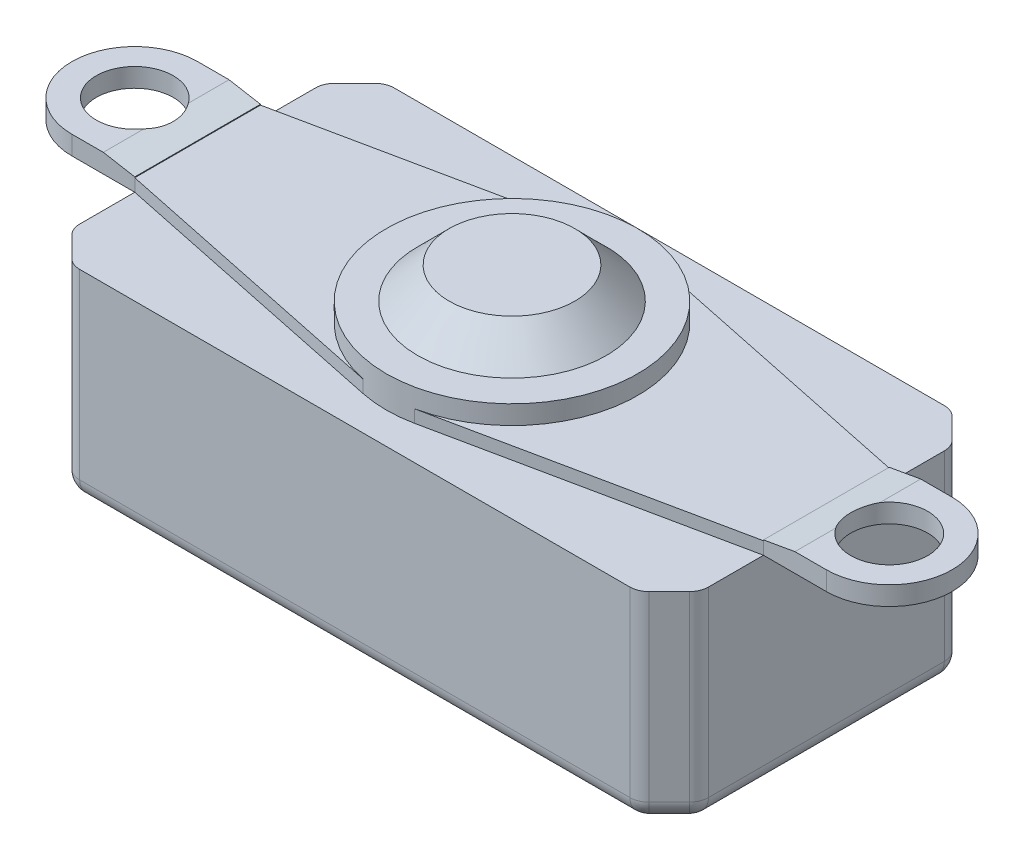
from build123d import *
from OCP.BRepFilletAPI import BRepFilletAPI_MakeChamfer

# Parameters (mm, degrees)
SKETCH1_W                               = 100
SKETCH1_H                               = 50
BOSS_EXTRUDE1_DEPTH                     = 16
SKETCH2_R                               = 20
BOSS_EXTRUDE2_DEPTH                     = 5
BOSS_EXTRUDE3_DEPTH                     = 2
BOSS_EXTRUDE4_DEPTH                     = 3
CHAMFER1_SIZE                           = 5
CHAMFER1_SIZE2                          = 0.881634904
SKETCH3_R                               = 15
BOSS_EXTRUDE5_DEPTH                     = 5
BOSS_EXTRUDE5_TAPER                     = 45
CBORE_FOR_M5_HEX_HEAD_BOLT1_D           = 5.3
CBORE_FOR_M5_HEX_HEAD_BOLT1_DEPTH       = 15
CBORE_FOR_M5_HEX_HEAD_BOLT1_CBORE_D     = 12.24
CBORE_FOR_M5_HEX_HEAD_BOLT1_CBORE_DEPTH = 3.58
CBORE_FOR_M5_HEX_HEAD_BOLT1_TIP         = 1.59228064
CHAMFER2_SIZE                           = 5
FILLET3_R                               = 3


# Read off the part's stored shape, not the designer's step: Boss-Extrude4
with BuildPart() as part:
    # Sketch1 → Boss-Extrude1 (new, symmetric)
    with BuildSketch(Plane(origin=(0, 0, 0), x_dir=(1, 0, 0), z_dir=(0, 1, 0))):
        Rectangle(SKETCH1_W, SKETCH1_H)
    extrude(amount=BOSS_EXTRUDE1_DEPTH, both=True)

    # Sketch2 → Boss-Extrude2 (add)
    with BuildSketch(Plane(origin=(0, 16, 0), x_dir=(1, 0, 0), z_dir=(0, 1, 0))):
        with Locations(Location((0, 0, 0), (0, 0, 90))):
            Circle(SKETCH2_R)
    extrude(amount=BOSS_EXTRUDE2_DEPTH)

    # Sketch2<3> → Boss-Extrude3 (add)
    with BuildSketch(Plane(origin=(0, 16, 0), x_dir=(1, 0, 0), z_dir=(0, 1, 0))):
        with BuildLine():
            Line((-4.084295569, 19.578522153), (-50, 10))
            Line((-50, 10), (-50, -10))
            Line((-50, -10), (-4.084295569, -19.578522153))
            ThreePointArc((-4.084295569, -19.578522153), (-20, 0), (-4.084295569, 19.578522153))
        make_face()
        with BuildLine():
            Line((50, 10), (4.084295569, 19.578522153))
            ThreePointArc((4.084295569, 19.578522153), (15.519115815, 12.615745888), (20, 0))
            ThreePointArc((20, 0), (15.519115815, -12.615745888), (4.084295569, -19.578522153))
            Line((4.084295569, -19.578522153), (50, -10))
            Line((50, -10), (50, 10))
        make_face()
    extrude(amount=BOSS_EXTRUDE3_DEPTH)

    # Boss-Extrude4 outline → Boss-Extrude4 (add)
    with BuildSketch(Plane(origin=(0, 16, 0), x_dir=(1, 0, 0), z_dir=(0, 1, 0))):
        with BuildLine():
            Line((-60, -10), (-50, -10))
            Line((-50, -10), (-50, 10))
            Line((-50, 10), (-60, 10))
            ThreePointArc((-60, 10), (-70, 0), (-60, -10))
        make_face()
        with BuildLine():
            ThreePointArc((60, -10), (70, 0), (60, 10))
            Line((60, 10), (50, 10))
            Line((50, 10), (50, -10))
            Line((50, -10), (60, -10))
        make_face()
    extrude(amount=BOSS_EXTRUDE4_DEPTH)

    # Chamfer1: one chamfer whose edges measure the first distance from different faces: ONE call of the kernel's chamfer builder (chamfer() names one face for all edges)
    chamfer1_edges_1 = [part.edges().sort_by_distance(p)[0] for p in [
        (-50, 19, 0),
    ]]
    chamfer1_side_1 = [part.faces().sort_by_distance(p)[0] for p in [
        (-59.066501411, 19, 0),
    ]]
    chamfer1_edges_2 = [part.edges().sort_by_distance(p)[0] for p in [
        (50, 19, 0),
    ]]
    chamfer1_side_2 = [part.faces().sort_by_distance(p)[0] for p in [
        (59.066501411, 19, 0),
    ]]
    chamfer1 = BRepFilletAPI_MakeChamfer(part.part.solid().wrapped)
    for e in chamfer1_edges_1:
        chamfer1.Add(CHAMFER1_SIZE, CHAMFER1_SIZE2, e.wrapped, chamfer1_side_1[0].wrapped)  # the first distance lies on this face
    for e in chamfer1_edges_2:
        chamfer1.Add(CHAMFER1_SIZE, CHAMFER1_SIZE2, e.wrapped, chamfer1_side_2[0].wrapped)  # the first distance lies on this face
    add(Compound.cast(chamfer1.Shape()), mode=Mode.REPLACE)

    # Sketch3 → Boss-Extrude5 (add)
    with BuildSketch(Plane(origin=(0, 21, 0), x_dir=(1, 0, 0), z_dir=(0, 1, 0))):
        Circle(SKETCH3_R)
    extrude(amount=BOSS_EXTRUDE5_DEPTH, taper=BOSS_EXTRUDE5_TAPER)

    # CBORE for M5 Hex Head Bolt1
    with Locations(Plane(origin=(-60, 19, 0), x_dir=(0, 0, 1), z_dir=(0, 1, 0))):
        with Locations((0, 0), (0, 120)):
            CounterBoreHole(CBORE_FOR_M5_HEX_HEAD_BOLT1_D / 2, CBORE_FOR_M5_HEX_HEAD_BOLT1_CBORE_D / 2, CBORE_FOR_M5_HEX_HEAD_BOLT1_CBORE_DEPTH, depth=CBORE_FOR_M5_HEX_HEAD_BOLT1_DEPTH)
            with Locations((0, 0, -(CBORE_FOR_M5_HEX_HEAD_BOLT1_DEPTH + CBORE_FOR_M5_HEX_HEAD_BOLT1_TIP / 2))):  # 118° drill point
                Cone(0, CBORE_FOR_M5_HEX_HEAD_BOLT1_D / 2, CBORE_FOR_M5_HEX_HEAD_BOLT1_TIP, mode=Mode.SUBTRACT)

    # Chamfer2
    chamfer2_edges = [part.edges().sort_by_distance(p)[0] for p in [
        (50, 0, 25),
        (-50, 0, 25),
        (-50, 0, -25),
        (50, 0, -25),
    ]]
    chamfer(chamfer2_edges, length=CHAMFER2_SIZE)

    # Fillet3
    fillet3_edges = [part.edges().sort_by_distance(p)[0] for p in [
        (-50, -16, 0),
        (-50, 0, 20),
        (-50, 0, -20),
        (50, -16, 0),
        (0, -16, 25),
        (0, -16, -25),
        (47.5, -16, 22.5),
        (-47.5, -16, 22.5),
        (47.5, -16, -22.5),
        (-47.5, -16, -22.5),
        (45, 0, -25),
        (-45, 0, -25),
        (50, 0, 20),
        (50, 0, -20),
        (45, 0, 25),
        (-45, 0, 25),
    ]]
    fillet(fillet3_edges, radius=FILLET3_R)


solid = part.part
